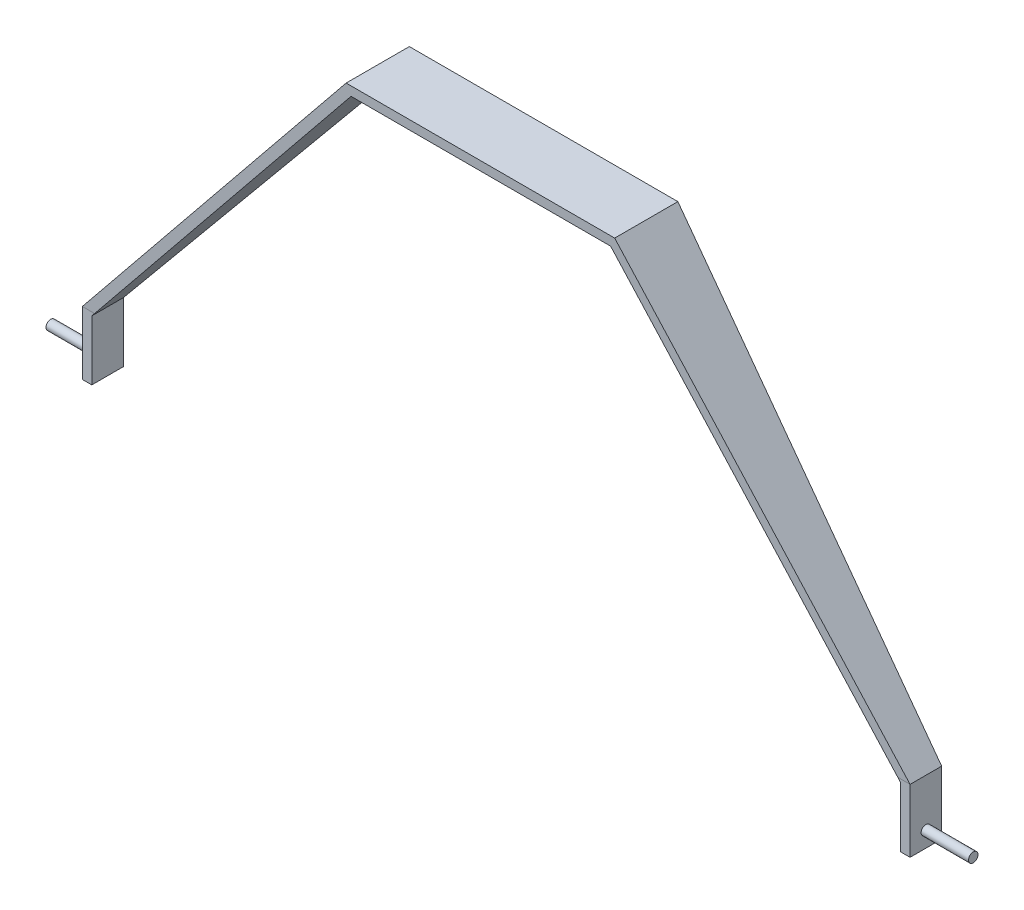
from build123d import *

# Parameters (mm, degrees)
BOSS_EXTRUDE1_DEPTH = 20
CUT_EXTRUDE1_DEPTH  = 293.280687012
SKETCH7_R           = 1.5
BOSS_EXTRUDE2_DEPTH = 15
BOSS_EXTRUDE3_START = 15
SKETCH8_R           = 1.5
BOSS_EXTRUDE3_DEPTH = 15


with BuildPart() as part:
    # Sketch5 → Boss-Extrude1 (new body)
    with BuildSketch(Plane.XY):
        Polygon((-42.5, 0), (-131, -108), (-131, -128), (-128, -128), (-128, -109.072168564), (-41.07975076, -3), (41.07975076, -3), (128, -109.072168564), (128, -128), (131, -128), (131, -108), (42.5, 0), align=None)
    extrude(amount=BOSS_EXTRUDE1_DEPTH)

    # Sketch6 → Cut-Extrude1 (cut, through all)
    with BuildSketch(Plane(origin=(131, 0, 0), x_dir=(0, 0, -1), z_dir=(1, 0, 0))):
        Polygon((-20, -128), (-15, -128), (-15, -108), (-20, 0), align=None)
        Polygon((-5, -108), (-5, -128), (0, -128), (0, 0), align=None)
    extrude(amount=-CUT_EXTRUDE1_DEPTH, mode=Mode.SUBTRACT)

    # Sketch7 → Boss-Extrude2 (add)
    with BuildSketch(Plane(origin=(131, 0, 0), x_dir=(0, 0, -1), z_dir=(1, 0, 0))):
        with Locations((-10, -123)):
            Circle(SKETCH7_R)
    extrude(amount=BOSS_EXTRUDE2_DEPTH)

    # Sketch8 → Boss-Extrude3 (add)
    with BuildSketch(Plane.ZY.offset(131).offset(BOSS_EXTRUDE3_START)):
        with Locations((10, -123)):
            Circle(SKETCH8_R)
    extrude(amount=-BOSS_EXTRUDE3_DEPTH)


solid = part.part
